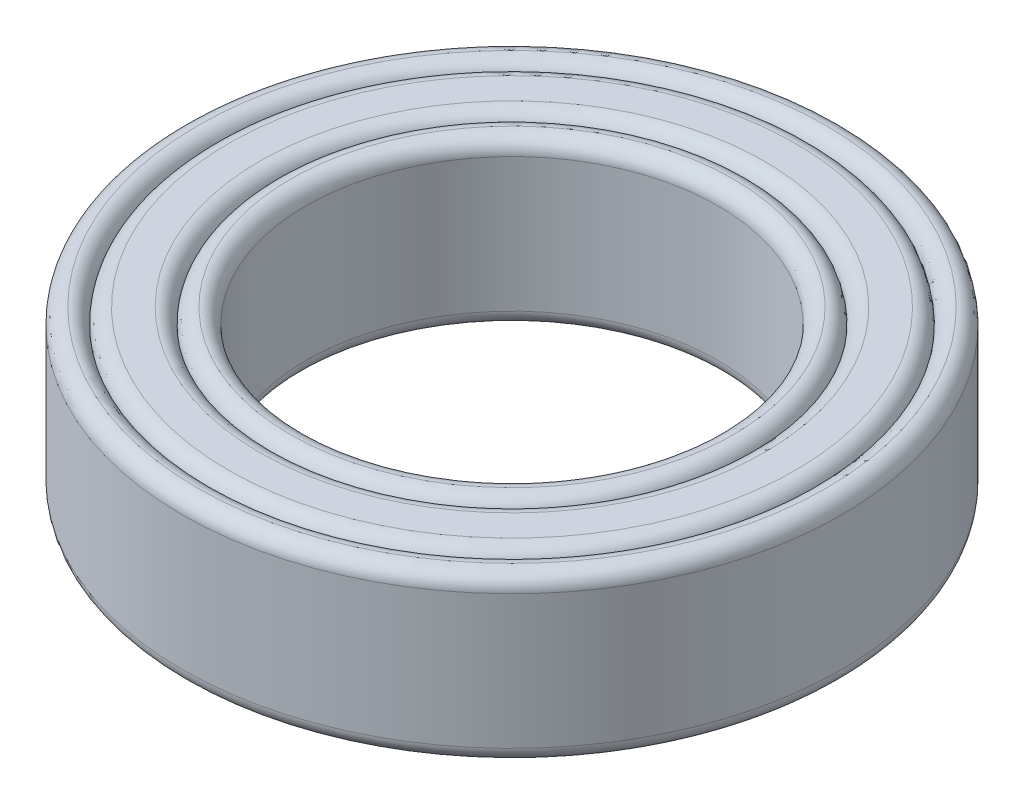
from build123d import *

# Parameters (mm, degrees)
SKETCH1_R                = 8
BOSS_EXTRUDE1_DEPTH      = 2
FILLET1_R                = 0.375
CUT_EXTRUDE1_DEPTH       = 12.489125432
CUT_EXTRUDE1_DEPTH_BACK  = 12.489125432
SKETCH2_R                = 7.25
FILLET2_R                = 0.375
BOSS_EXTRUDE2_DEPTH      = 2
BOSS_EXTRUDE2_DEPTH_BACK = 2
SKETCH3_R                = 7.25
FILLET3_R                = 0.375
CUT_EXTRUDE2_DEPTH       = 12.489125432
CUT_EXTRUDE2_DEPTH_BACK  = 12.489125432
SKETCH4_R                = 5.75
FILLET4_R                = 0.375
BOSS_EXTRUDE3_DEPTH      = 2
BOSS_EXTRUDE3_DEPTH_BACK = 2
SKETCH5_R                = 5.75
FILLET5_R                = 0.375
CUT_EXTRUDE3_DEPTH       = 12.489125432
CUT_EXTRUDE3_DEPTH_BACK  = 12.489125432
SKETCH6_R                = 5
FILLET6_R                = 0.375


# Some blends are built 0.0001 mm under size
with BuildPart() as part:
    # Sketch1 → Boss-Extrude1 (new, symmetric)
    with BuildSketch(Plane(origin=(0, 0, 0), x_dir=(1, 0, 0), z_dir=(0, 1, 0))):
        with Locations(Location((0, 0, 0), (0, 0, 270))):
            Circle(SKETCH1_R)
    extrude(amount=BOSS_EXTRUDE1_DEPTH, both=True)

    # Fillet1
    fillet1_edges = [part.edges().sort_by_distance(p)[0] for p in [
        (0, -2, -8),
        (0, 2, -8),
    ]]
    fillet(fillet1_edges, radius=FILLET1_R)

    # Sketch2 → Cut-Extrude1 (cut, two sides: drawn at the far end of the back side and taken through both)
    with BuildSketch(Plane(origin=(0, 0, 0), x_dir=(1, 0, 0), z_dir=(0, 1, 0)).offset(-CUT_EXTRUDE1_DEPTH_BACK)):
        with Locations(Location((0, 0, 0), (0, 0, 270))):
            Circle(SKETCH2_R)
    extrude(amount=CUT_EXTRUDE1_DEPTH + CUT_EXTRUDE1_DEPTH_BACK, mode=Mode.SUBTRACT)

    # Fillet2
    fillet2_edges = [part.edges().sort_by_distance(p)[0] for p in [
        (0, -2, -7.25),
        (0, 2, -7.25),
    ]]
    fillet(fillet2_edges, radius=FILLET2_R - 0.0001)  # a hair under: the kernel refuses the full size

    # Sketch3 → Boss-Extrude2 (add, two sides: drawn at the far end of the back side and taken through both)
    with BuildSketch(Plane(origin=(0, 0, 0), x_dir=(1, 0, 0), z_dir=(0, 1, 0)).offset(-BOSS_EXTRUDE2_DEPTH_BACK)):
        with Locations(Location((0, 0, 0), (0, 0, 270))):
            Circle(SKETCH3_R)
    extrude(amount=BOSS_EXTRUDE2_DEPTH + BOSS_EXTRUDE2_DEPTH_BACK)

    # Fillet3
    # the kernel refuses this fillet: 0.375 mm, written as the material it takes off along each edge
    with BuildSketch(Plane(origin=(0, -2, 0), x_dir=(0, 0, 1), z_dir=(-1, 0, 0))) as fillet3_piece_1:
        with BuildLine():
            CenterArc((6.875000013, 0.375), FILLET3_R, 270, 89.984721125)
            Line((6.875000013, 0), (7.25, 0))
            Line((7.25, 0), (7.25, 0.3749))
        make_face()
    revolve(axis=Axis((0, -2, 0), (0, 1, 0)), mode=Mode.SUBTRACT)
    with BuildSketch(Plane(origin=(0, 2, 0), x_dir=(0, 0, 1), z_dir=(-1, 0, 0))) as fillet3_piece_2:
        with BuildLine():
            CenterArc((6.875000013, -0.375), FILLET3_R, 0.015278875, 89.984721125)
            Line((6.875000013, 0), (7.25, 0))
            Line((7.25, 0), (7.25, -0.3749))
        make_face()
    revolve(axis=Axis((0, 2, 0), (0, 1, 0)), mode=Mode.SUBTRACT)

    # Sketch4 → Cut-Extrude2 (cut, two sides: drawn at the far end of the back side and taken through both)
    with BuildSketch(Plane(origin=(0, 0, 0), x_dir=(1, 0, 0), z_dir=(0, 1, 0)).offset(-CUT_EXTRUDE2_DEPTH_BACK)):
        with Locations(Location((0, 0, 0), (0, 0, 270))):
            Circle(SKETCH4_R)
    extrude(amount=CUT_EXTRUDE2_DEPTH + CUT_EXTRUDE2_DEPTH_BACK, mode=Mode.SUBTRACT)

    # Fillet4
    fillet4_edges = [part.edges().sort_by_distance(p)[0] for p in [
        (0, -2, -5.75),
        (0, 2, -5.75),
    ]]
    fillet(fillet4_edges, radius=FILLET4_R)

    # Sketch5 → Boss-Extrude3 (add, two sides: drawn at the far end of the back side and taken through both)
    with BuildSketch(Plane(origin=(0, 0, 0), x_dir=(1, 0, 0), z_dir=(0, 1, 0)).offset(-BOSS_EXTRUDE3_DEPTH_BACK)):
        with Locations(Location((0, 0, 0), (0, 0, 270))):
            Circle(SKETCH5_R)
    extrude(amount=BOSS_EXTRUDE3_DEPTH + BOSS_EXTRUDE3_DEPTH_BACK)

    # Fillet5
    fillet5_edges = [part.edges().sort_by_distance(p)[0] for p in [
        (0, -2, -5.75),
        (0, 2, -5.75),
    ]]
    fillet(fillet5_edges, radius=FILLET5_R - 0.0001)  # a hair under: the kernel refuses the full size

    # Sketch6 → Cut-Extrude3 (cut, two sides: drawn at the far end of the back side and taken through both)
    with BuildSketch(Plane(origin=(0, 0, 0), x_dir=(1, 0, 0), z_dir=(0, 1, 0)).offset(-CUT_EXTRUDE3_DEPTH_BACK)):
        with Locations(Location((0, 0, 0), (0, 0, 270))):
            Circle(SKETCH6_R)
    extrude(amount=CUT_EXTRUDE3_DEPTH + CUT_EXTRUDE3_DEPTH_BACK, mode=Mode.SUBTRACT)

    # Fillet6
    fillet6_edges = [part.edges().sort_by_distance(p)[0] for p in [
        (0, -2, -5),
        (0, 2, -5),
    ]]
    fillet(fillet6_edges, radius=FILLET6_R)


solid = part.part
